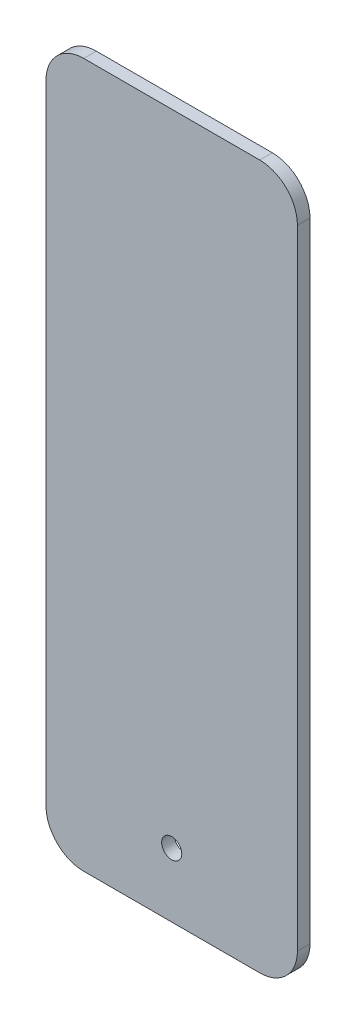
from build123d import *

# Parameters (mm, degrees)
SKETCH1_R          = 4
BASE_FLANGE1_DEPTH = 5


# Sheet-metal steps are written as plain solids
with BuildPart() as part:
    # Sketch1 → Base-Flange1 (new body)
    with BuildSketch(Plane.XY):
        with BuildLine():
            Line((-35, 140), (35, 140))
            ThreePointArc((35, 140), (45.606601718, 135.606601718), (50, 125))
            Line((50, 125), (50, -125))
            ThreePointArc((50, -125), (45.606601718, -135.606601718), (35, -140))
            Line((35, -140), (-35, -140))
            ThreePointArc((-35, -140), (-45.606601718, -135.606601718), (-50, -125))
            Line((-50, -125), (-50, 125))
            ThreePointArc((-50, 125), (-45.606601718, 135.606601718), (-35, 140))
        make_face()
        with Locations((0, -114.537631935)):
            Circle(SKETCH1_R, mode=Mode.SUBTRACT)
    extrude(amount=-BASE_FLANGE1_DEPTH)


solid = part.part
